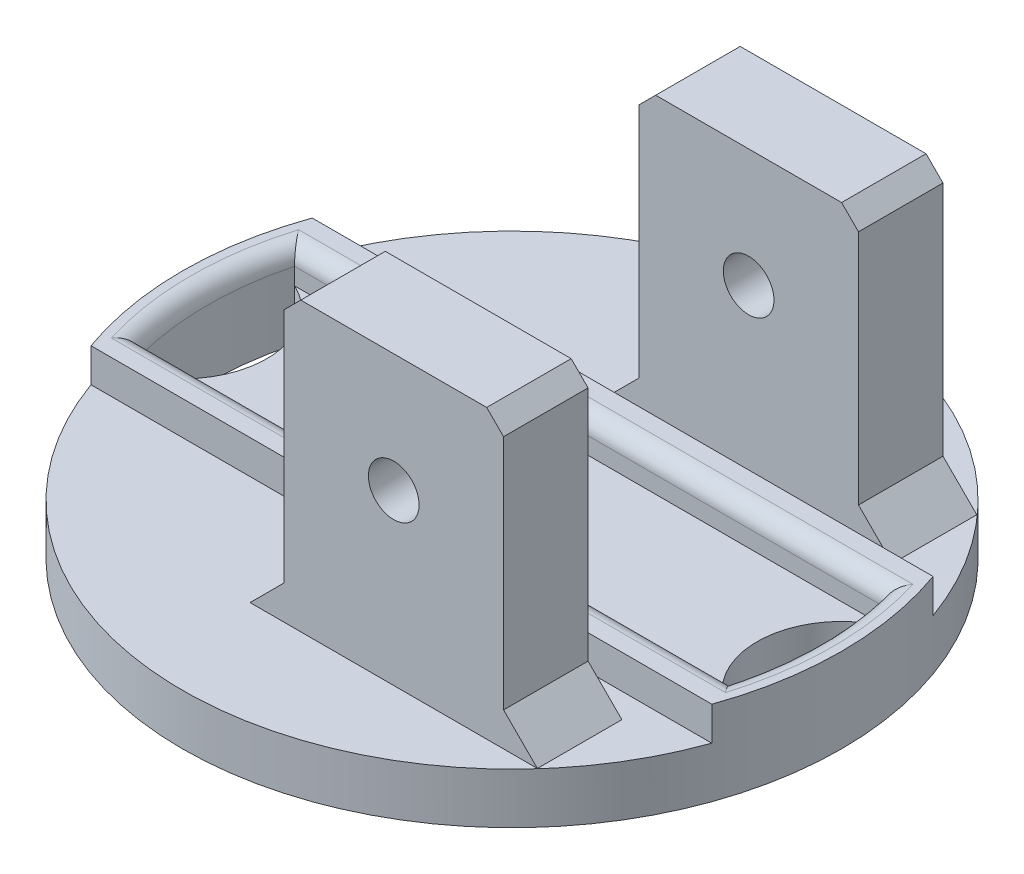
from build123d import *

# Parameters (mm, degrees)
SKETCH1_R           = 24.765
PLATE_DEPTH         = 3.81
SKETCH2_W           = 16.51
SKETCH2_H           = 6.35
HOOK_UPRIGHTS_DEPTH = 21.59
SKETCH3_R           = 1.905
HOOK_BOLTHOLE_DEPTH = 55.425093937
BOSS_EXTRUDE1_DEPTH = 2.54
FILLET1_R           = 1.27
CHAMFER1_SIZE       = 1.27
CHAMFER2_SIZE       = 2.54


with BuildPart() as part:
    # Sketch1 → plate (new body)
    with BuildSketch(Plane(origin=(0, 0, 0), x_dir=(1, 0, 0), z_dir=(0, 1, 0))):
        Circle(SKETCH1_R)
        with BuildLine():
            ThreePointArc((-22.119166667, -5.772526827), (-22.86, 0), (-22.119166667, 5.772526827))
            ThreePointArc((-22.119166667, 5.772526827), (-18.415, 0), (-22.119166667, -5.772526827))
        make_face(mode=Mode.SUBTRACT)
        with BuildLine():
            ThreePointArc((22.119166667, -5.772526827), (18.415, 0), (22.119166667, 5.772526827))
            ThreePointArc((22.119166667, 5.772526827), (22.86, 0), (22.119166667, -5.772526827))
        make_face(mode=Mode.SUBTRACT)
    extrude(amount=PLATE_DEPTH)

    # Sketch2 → hook_uprights (add)
    with BuildSketch(Plane(origin=(0, 3.81, 0), x_dir=(1, 0, 0), z_dir=(0, 1, 0))):
        with Locations((7.62, 13.335)):
            Rectangle(SKETCH2_W, SKETCH2_H)
        with Locations((7.62, -13.335)):
            Rectangle(SKETCH2_W, SKETCH2_H)
    extrude(amount=HOOK_UPRIGHTS_DEPTH)

    # Sketch3 → hook_bolthole (cut, through all)
    with BuildSketch(Plane(origin=(0, 0, -16.51), x_dir=(-1, 0, 0), z_dir=(0, 0, -1))):
        with Locations((-7.62, 16.51)):
            Circle(SKETCH3_R)
    extrude(amount=-HOOK_BOLTHOLE_DEPTH, mode=Mode.SUBTRACT)

    # Sketch4 → Boss-Extrude1 (add)
    with BuildSketch(Plane(origin=(0, 3.81, 0), x_dir=(1, 0, 0), z_dir=(0, 1, 0))):
        with BuildLine():
            ThreePointArc((-23.328247314, 8.312526827), (-24.765, 0), (-23.328247314, -8.312526827))
            Line((-23.328247314, -8.312526827), (23.328247314, -8.312526827))
            ThreePointArc((23.328247314, -8.312526827), (24.765, 0), (23.328247314, 8.312526827))
            Line((23.328247314, 8.312526827), (-23.328247314, 8.312526827))
        make_face()
        with BuildLine():
            ThreePointArc((22.119166667, 5.772526827), (22.86, 0), (22.119166667, -5.772526827))
            Line((22.119166667, -5.772526827), (-22.119166667, -5.772526827))
            ThreePointArc((-22.119166667, -5.772526827), (-22.86, 0), (-22.119166667, 5.772526827))
            Line((-22.119166667, 5.772526827), (22.119166667, 5.772526827))
        make_face(mode=Mode.SUBTRACT)
    extrude(amount=BOSS_EXTRUDE1_DEPTH)

    # Fillet1
    fillet1_edges = [part.edges().sort_by_distance(p)[0] for p in [
        (22.86, 6.35, 0),
        (0, 6.35, 5.772526827),
        (-22.86, 6.35, 0),
        (0, 6.35, -5.772526827),
    ]]
    fillet(fillet1_edges, radius=FILLET1_R)

    # Chamfer1
    chamfer1_edges = [part.edges().sort_by_distance(p)[0] for p in [
        (15.875, 25.4, 13.335),
        (15.875, 25.4, -13.335),
        (-0.635, 25.4, 13.335),
        (-0.635, 25.4, -13.335),
    ]]
    chamfer(chamfer1_edges, length=CHAMFER1_SIZE)

    # Chamfer2
    chamfer2_edges = [part.edges().sort_by_distance(p)[0] for p in [
        (-0.635, 3.81, -13.335),
        (15.875, 3.81, -13.335),
        (15.875, 3.81, 13.335),
        (-0.635, 3.81, 13.335),
    ]]
    chamfer(chamfer2_edges, length=CHAMFER2_SIZE)


solid = part.part
